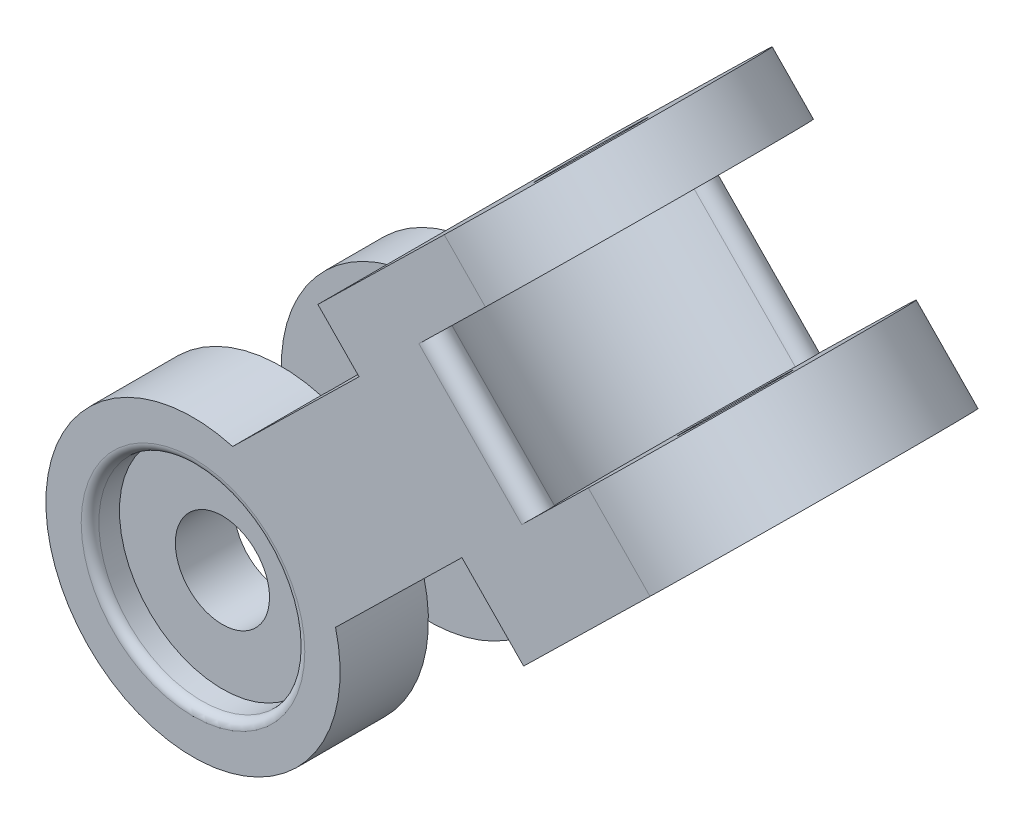
from build123d import *

# Parameters (mm, degrees)
SKETCH1_R               = 1.6
BOSS_EXTRUDE1_DEPTH     = 2
BOSS_EXTRUDE2_START     = -8
SKETCH1_3_R             = 1.6
BOSS_EXTRUDE2_DEPTH     = 8
SKETCH2_R               = 5
CUT_EXTRUDE1_DEPTH      = 5
SKETCH7_R               = 1.6
BOSS_EXTRUDE5_DEPTH     = 2
BOSS_EXTRUDE6_START     = -8
BOSS_EXTRUDE6_OUTLINE_R = 1.6
BOSS_EXTRUDE6_DEPTH     = 8
CUT_EXTRUDE4_START      = 5
SKETCH8_R               = 5
CUT_EXTRUDE4_DEPTH      = 5
SKETCH10_R              = 3.5
SKETCH10_R_2            = 1.6
CUT_EXTRUDE5_DEPTH      = 1
FILLET2_R               = 0.5
FILLET3_R               = 0.3
CUT_EXTRUDE6_START      = -1
SKETCH11_R              = 3.5
SKETCH11_R_2            = 1.6
CUT_EXTRUDE6_DEPTH      = 1
FILLET4_R               = 0.3


# Read off the part's stored shape, not the designer's step: Boss-Extrude6
with BuildPart() as part:
    # Sketch1 → Boss-Extrude1 (new body)
    with BuildSketch(Plane.XY):
        with BuildLine():
            Line((13.181503179, 9.65917228), (9.685706637, 13.234001861))
            Line((9.685706637, 13.234001861), (1.09631205, 4.834503308))
            ThreePointArc((1.09631205, 4.834503308), (-3.826512492, -3.476156637), (4.592108592, 1.259673726))
            Line((4.592108592, 1.259673726), (13.181503179, 9.65917228))
        make_face()
        with Locations((-0.251682911, 0.019639905)):
            Circle(SKETCH1_R, mode=Mode.SUBTRACT)
    extrude(amount=BOSS_EXTRUDE1_DEPTH)

    # Sketch1<3> → Boss-Extrude2 (add)
    with BuildSketch(Plane.XY.offset(BOSS_EXTRUDE2_START)):
        with BuildLine():
            Line((13.181503179, 9.65917228), (9.685706637, 13.234001861))
            Line((9.685706637, 13.234001861), (1.09631205, 4.834503308))
            ThreePointArc((1.09631205, 4.834503308), (-3.826512492, -3.476156637), (4.592108592, 1.259673726))
            Line((4.592108592, 1.259673726), (13.181503179, 9.65917228))
        make_face()
        with Locations(Location((-0.251682911, 0.019639905, 0), (0, 0, 180))):
            Circle(SKETCH1_3_R, mode=Mode.SUBTRACT)
    extrude(amount=BOSS_EXTRUDE2_DEPTH)

    # Sketch2 → Cut-Extrude1 (cut)
    with BuildSketch(Plane(origin=(0, 0, -6), x_dir=(-1, 0, 0), z_dir=(0, 0, -1))):
        with Locations((0.251682911, 0.019639905)):
            Circle(SKETCH2_R)
    extrude(amount=-CUT_EXTRUDE1_DEPTH, mode=Mode.SUBTRACT)

    # Sketch7 → Boss-Extrude5 (add)
    with BuildSketch(Plane(origin=(-1.880744352, 1.923264258, 0), x_dir=(0.7149659162500773, 0.6991593084560109, 0), z_dir=(-0.6991593084560109, 0.7149659162500773, 0))):
        with BuildLine():
            Line((16.17762571, 8), (10.170769724, 8))
            Line((10.170769724, 8), (10.170769724, -2))
            Line((10.170769724, -2), (16.17762571, -2))
            ThreePointArc((16.17762571, -2), (21.17762571, 3), (16.17762571, 8))
        make_face()
        with Locations(Location((16.17762571, 3, 0), (0, 0, 270))):
            Circle(SKETCH7_R, mode=Mode.SUBTRACT)
    extrude(amount=BOSS_EXTRUDE5_DEPTH)

    # Boss-Extrude6 outline → Boss-Extrude6 (add)
    with BuildSketch(Plane(origin=(-1.880744352, 1.923264258, 0), x_dir=(0.7149659162500773, 0.6991593084560109, 0), z_dir=(-0.6991593084560109, 0.7149659162500773, 0)).offset(BOSS_EXTRUDE6_START)):
        with BuildLine():
            Line((10.170769724, 8), (10.170769724, -2))
            Line((10.170769724, -2), (16.17762571, -2))
            ThreePointArc((16.17762571, -2), (21.17762571, 3), (16.17762571, 8))
            Line((16.17762571, 8), (10.170769724, 8))
        make_face()
        with Locations((16.17762571, 3)):
            Circle(BOSS_EXTRUDE6_OUTLINE_R, mode=Mode.SUBTRACT)
    extrude(amount=BOSS_EXTRUDE6_DEPTH)

    # Sketch8 → Cut-Extrude4 (cut)
    with BuildSketch(Plane(origin=(-1.880744352, 1.923264258, 0), x_dir=(0.7149659162500772, 0.699159308456011, 0), z_dir=(0.699159308456011, -0.7149659162500772, 0)).offset(CUT_EXTRUDE4_START)):
        with Locations((16.17762571, -3)):
            Circle(SKETCH8_R)
    extrude(amount=-CUT_EXTRUDE4_DEPTH, mode=Mode.SUBTRACT)

    # Sketch10 → Cut-Extrude5 (cut)
    with BuildSketch(Plane(origin=(3.712530116, -3.796463072, 0), x_dir=(0.7149659162500772, 0.699159308456011, 0), z_dir=(0.699159308456011, -0.7149659162500772, 0))):
        with Locations((16.17762571, -3)):
            Circle(SKETCH10_R)
        with Locations((16.17762571, -3)):
            Circle(SKETCH10_R_2, mode=Mode.SUBTRACT)
    extrude(amount=-CUT_EXTRUDE5_DEPTH, mode=Mode.SUBTRACT)

    # Fillet2
    fillet2_edges = [part.edges().sort_by_distance(p)[0] for p in [
        (11.433604908, 11.446587071, 2),
        (11.433604908, 11.446587071, -8),
    ]]
    fillet(fillet2_edges, radius=FILLET2_R)

    # Fillet3
    fillet3_edges = [part.edges().sort_by_distance(p)[0] for p in [
        (4.592108592, 1.259673726, -3.5),
        (1.09631205, 4.834503308, -3.5),
    ]]
    fillet(fillet3_edges, radius=FILLET3_R)

    # Sketch11 → Cut-Extrude6 (cut)
    with BuildSketch(Plane.XY.offset(2).offset(CUT_EXTRUDE6_START)):
        with Locations((-0.251682911, 0.019639905)):
            Circle(SKETCH11_R)
        with Locations(Location((-0.251682911, 0.019639905, 0), (0, 0, 180))):
            Circle(SKETCH11_R_2, mode=Mode.SUBTRACT)
    extrude(amount=CUT_EXTRUDE6_DEPTH, mode=Mode.SUBTRACT)

    # Fillet4
    fillet4_edges = [part.edges().sort_by_distance(p)[0] for p in [
        (-3.751682911, 0.019639905, 2),
    ]]
    fillet(fillet4_edges, radius=FILLET4_R)


solid = part.part
